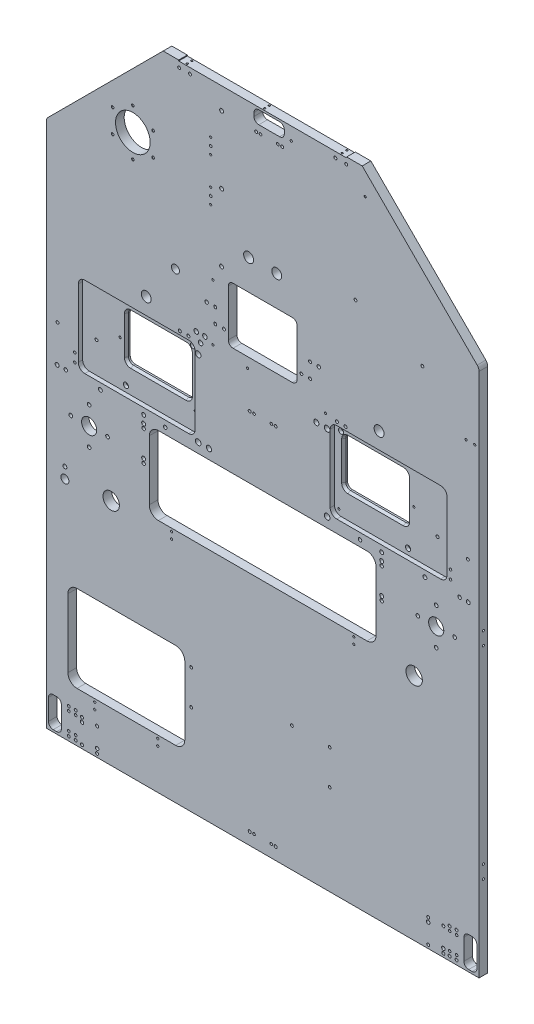
from build123d import *
from OCP.BRepFilletAPI import BRepFilletAPI_MakeChamfer

# Parameters (mm, degrees)
SKIZZE1_R                                            = 11.5
SKIZZE1_R_2                                          = 19
LINEAR_AUSTRAGEN1_DEPTH                              = 20
SCHNITT_LINEAR_AUSTRAGEN1_DEPTH                      = 10
SKIZZE5_R                                            = 11.5
SCHNITT_LINEAR_AUSTRAGEN2_DEPTH                      = 1795.575158638
M8_GEWINDEBOHRUNG1_F_R_ABST_TZUNG_D                  = 6.8
M8_GEWINDEKERNLOCH5_F_R_AUSLAUFSPLATTE_D             = 6.8
M6_F_R_DAS_BLECH_GEGEN_KLAPPE2_D                     = 5
M6_F_R_DAS_BLECH_GEGEN_KLAPPE2_DEPTH                 = 17
M6_F_R_DAS_BLECH_GEGEN_KLAPPE2_TIP                   = 1.502151548
M8_GEWINDEBOHRUNG1_D                                 = 6.8
M8_GEWINDEBOHRUNG1_DEPTH                             = 22.25
M8_GEWINDEBOHRUNG1_TIP                               = 2.042926105
M8_GEWINDEBOHRUNG2_D                                 = 6.8
M8_GEWINDEBOHRUNG2_DEPTH                             = 22.25
M8_GEWINDEBOHRUNG2_TIP                               = 2.042926105
SKIZZE70_R                                           = 17.5
SCHNITT_LINEAR_AUSTRAGEN4_DEPTH                      = 20
F_8_5_8_5_DURCHMESSER_BOHRUNG1_D                     = 8.5
SKIZZE76_R                                           = 35
SCHNITT_LINEAR_AUSTRAGEN6_F_R_DEN_ZYKLUS_DEPTH       = 3
F_8_0_8_DURCHMESSER_BOHRUNG1_D                       = 8
F_8_5_8_5_F_R_DIE_GETRIEBESHALTER_D                  = 9
F_8_5_8_5_F_R_DIE_GETRIEBESHALTER_CBORE_D            = 15
F_8_5_8_5_F_R_DIE_GETRIEBESHALTER_CBORE_DEPTH        = 8
FASE2_SIZE                                           = 3.5
FASE2_SIZE2                                          = 6.062177826
F_8_0_8_DURCHMESSER_BOHRUNG2_D                       = 8
F_8_0_8_DURCHMESSER_BOHRUNG2_DEPTH                   = 9
F_8_0_8_DURCHMESSER_BOHRUNG2_TIP                     = 2.403442476
M6_GEWINDEBOHRUNG1_F_R_RUTSCHE_D                     = 5
M6_GEWINDEBOHRUNG1_F_R_RUTSCHE_DEPTH                 = 17
M6_GEWINDEBOHRUNG1_F_R_RUTSCHE_CSINK_D               = 6.05
M6_GEWINDEBOHRUNG1_F_R_RUTSCHE_CSINK_ANGLE           = 90
M6_GEWINDEBOHRUNG1_F_R_RUTSCHE_TIP                   = 1.502151548
F_9_0_9_DURCHMESSER_BOHRUNG1_D                       = 9
F_13_0_13_DURCHMESSER_BOHRUNG1_D                     = 13
F_7_0_7_DURCHMESSER_BOHRUNG1_D                       = 7
M6_GEWINDEBOHRUNG1_D                                 = 5
M6_GEWINDEBOHRUNG1_DEPTH                             = 17
M6_GEWINDEBOHRUNG1_CSINK_D                           = 6.05
M6_GEWINDEBOHRUNG1_CSINK_ANGLE                       = 90
M6_GEWINDEBOHRUNG1_TIP                               = 1.502151548
SCHNITT_LINEAR_AUSTRAGEN6_DEPTH                      = 30
F_12_0_12_DURCHMESSER_BOHRUNG1_D                     = 12
F_12_0_12_DURCHMESSER_BOHRUNG1_DEPTH                 = 15
F_12_0_12_DURCHMESSER_BOHRUNG1_TIP                   = 3.605163714
M8_GEWINDEBOHRUNG1_F_R_DIE_T_REN_D                   = 6.8
VERRUNDUNG1_R                                        = 15
F_6_0_6_DURCHMESSER_BOHRUNG3_D                       = 6
F_6_0_6_DURCHMESSER_BOHRUNG3_DEPTH                   = 20
F_6_0_6_DURCHMESSER_BOHRUNG3_TIP                     = 1.802581857
F_12_0_12_DURCHM_F_R_GETRIEBE_POSITIONIE_D           = 12
F_12_0_12_DURCHM_F_R_GETRIEBE_POSITIONIE_DEPTH       = 7
M8_GEWINDEBOHRUNG1_F_R_DIE_FUSS_D                    = 6.8
F_8_0_8_DURCHMESSER_BOHRUNG3_D                       = 8
F_8_0_8_DURCHMESSER_BOHRUNG3_DEPTH                   = 20
F_8_0_8_DURCHMESSER_BOHRUNG3_TIP                     = 2.403442476
SKIZZE113_W                                          = 388
SKIZZE113_H                                          = 20
SCHNITT_LINEAR_AUSTRAGEN7_DEPTH                      = 2
M5_GEWINDEBOHRUNG1_D                                 = 4.2
M5_GEWINDEBOHRUNG1_DEPTH                             = 14
M5_GEWINDEBOHRUNG1_TIP                               = 1.2618073
M5_GEWINDEBOHRUNG2_D                                 = 4.2
M5_GEWINDEBOHRUNG2_DEPTH                             = 14
M5_GEWINDEBOHRUNG2_CSINK_D                           = 5.05
M5_GEWINDEBOHRUNG2_CSINK_ANGLE                       = 90
M5_GEWINDEBOHRUNG2_TIP                               = 1.2618073
M6_GEWINDEBOHRUNG2_D                                 = 5
M6_GEWINDEBOHRUNG2_DEPTH                             = 17
M6_GEWINDEBOHRUNG2_TIP                               = 1.502151548
M5_GEWINDEBOHRUNG3_D                                 = 4.2
M5_GEWINDEBOHRUNG3_DEPTH                             = 14
M5_GEWINDEBOHRUNG3_TIP                               = 1.2618073
M5_GEWINDEBOHRUNG4_D                                 = 4.2
M5_GEWINDEBOHRUNG4_DEPTH                             = 14
M5_GEWINDEBOHRUNG4_CSINK_D                           = 5.05
M5_GEWINDEBOHRUNG4_CSINK_ANGLE                       = 90
M5_GEWINDEBOHRUNG4_TIP                               = 1.2618073
M6_GEWINDEBOHRUNG4_D                                 = 5
M6_GEWINDEBOHRUNG4_DEPTH                             = 17
M6_GEWINDEBOHRUNG4_TIP                               = 1.502151548
M6_GEWINDEBOHRUNG5_D                                 = 5
M6_GEWINDEBOHRUNG5_DEPTH                             = 17
M6_GEWINDEBOHRUNG5_TIP                               = 1.502151548
M6_GEWINDEBOHRUNG7_D                                 = 5
M6_GEWINDEBOHRUNG7_DEPTH                             = 17
M6_GEWINDEBOHRUNG7_TIP                               = 1.502151548
M6_GEWINDEBOHRUNG8_D                                 = 5
M6_GEWINDEBOHRUNG8_DEPTH                             = 17
M6_GEWINDEBOHRUNG8_TIP                               = 1.502151548
M12X1_5_GEWINDEBOHRUNG1_D                            = 10.5
M6_GEWINDEBOHRUNG9_D                                 = 5
M6_GEWINDEBOHRUNG9_DEPTH                             = 17
M6_GEWINDEBOHRUNG9_TIP                               = 1.502151548
F_6_0MM_STIFTLOCH1_D                                 = 6
F_6_0MM_STIFTLOCH1_DEPTH                             = 12
F_6_0MM_STIFTLOCH1_TIP                               = 1.802581857
SCHNITT_LINEAR_AUSTRAGEN8_DEPTH                      = 1795.575158638
DURCHGANGSLOCH_F_R_M61_D                             = 6.6
M6_GEWINDEBOHRUNG10_D                                = 5
M6_GEWINDEBOHRUNG10_DEPTH                            = 17
M6_GEWINDEBOHRUNG10_TIP                              = 1.502151548
M20X1_5_GEWINDEBOHRUNG1_D                            = 18.5
DURCHGANGSLOCH_F_R_M81_D                             = 9
SKIZZE157_R                                          = 40
SCHNITT_LINEAR_AUSTRAGEN9_DEPTH                      = 1795.575158638
M6_GEWINDEBOHRUNG11_D                                = 5
M6_GEWINDEBOHRUNG11_CSINK_D                          = 6.05
M6_GEWINDEBOHRUNG11_CSINK_ANGLE                      = 90
FORMSENKUNG_F_R_M6_SENKSCHRAUBE_MIT_INNE_D           = 6
FORMSENKUNG_F_R_M6_SENKSCHRAUBE_MIT_INNE_CSINK_D     = 13
FORMSENKUNG_F_R_M6_SENKSCHRAUBE_MIT_INNE_CSINK_ANGLE = 90


with BuildPart() as part:
    # Skizze1 → Linear austragen1 (new body)
    with BuildSketch(Plane.XY):
        Polygon((-270, 1490), (0, 1220), (0, 0), (-1000, 0), (-1000, 1220), (-730, 1490), align=None)
        with Locations((-231, 979)):
            Circle(SKIZZE1_R, mode=Mode.SUBTRACT)
        with Locations((-769, 979)):
            Circle(SKIZZE1_R, mode=Mode.SUBTRACT)
        with Locations((-850, 530)):
            Circle(SKIZZE1_R_2, mode=Mode.SUBTRACT)
        with Locations((-150, 530)):
            Circle(SKIZZE1_R_2, mode=Mode.SUBTRACT)
        with BuildLine():
            Line((-259, 725), (-741, 725))
            ThreePointArc((-741, 725), (-755.849242405, 718.849242405), (-762, 704))
            Line((-762, 704), (-762, 566))
            ThreePointArc((-762, 566), (-755.849242405, 551.150757595), (-741, 545))
            Line((-741, 545), (-259, 545))
            ThreePointArc((-259, 545), (-244.150757595, 551.150757595), (-238, 566))
            Line((-238, 566), (-238, 704))
            ThreePointArc((-238, 704), (-244.150757595, 718.849242405), (-259, 725))
        make_face(mode=Mode.SUBTRACT)
        with BuildLine():
            Line((-826, 822), (-826, 910))
            ThreePointArc((-826, 910), (-822.778174593, 917.778174593), (-815, 921))
            Line((-815, 921), (-687, 921))
            ThreePointArc((-687, 921), (-679.221825407, 917.778174593), (-676, 910))
            Line((-676, 910), (-676, 822))
            ThreePointArc((-676, 822), (-679.221825407, 814.221825407), (-687, 811))
            Line((-687, 811), (-815, 811))
            ThreePointArc((-815, 811), (-822.778174593, 814.221825407), (-826, 822))
        make_face(mode=Mode.SUBTRACT)
        with BuildLine():
            Line((-185, 811), (-313, 811))
            ThreePointArc((-313, 811), (-320.778174593, 814.221825407), (-324, 822))
            Line((-324, 822), (-324, 910))
            ThreePointArc((-324, 910), (-320.778174593, 917.778174593), (-313, 921))
            Line((-313, 921), (-185, 921))
            ThreePointArc((-185, 921), (-177.221825407, 917.778174593), (-174, 910))
            Line((-174, 910), (-174, 822))
            ThreePointArc((-174, 822), (-177.221825407, 814.221825407), (-185, 811))
        make_face(mode=Mode.SUBTRACT)
    extrude(amount=LINEAR_AUSTRAGEN1_DEPTH)

    # Skizze4 → Schnitt-Linear austragen1 (cut)
    with BuildSketch(Plane.XY.offset(20)):
        with BuildLine():
            Line((-329, 941), (-89, 941))
            ThreePointArc((-89, 941), (-78.393398282, 936.606601718), (-74, 926))
            Line((-74, 926), (-74, 769))
            ThreePointArc((-74, 769), (-78.393398282, 758.393398282), (-89, 754))
            Line((-89, 754), (-329, 754))
            ThreePointArc((-329, 754), (-339.606601718, 758.393398282), (-344, 769))
            Line((-344, 769), (-344, 926))
            ThreePointArc((-344, 926), (-339.606601718, 936.606601718), (-329, 941))
        make_face()
        with BuildLine():
            Line((-911, 941), (-671, 941))
            ThreePointArc((-671, 941), (-660.393398282, 936.606601718), (-656, 926))
            Line((-656, 926), (-656, 769))
            ThreePointArc((-656, 769), (-660.393398282, 758.393398282), (-671, 754))
            Line((-671, 754), (-911, 754))
            ThreePointArc((-911, 754), (-921.606601718, 758.393398282), (-926, 769))
            Line((-926, 769), (-926, 926))
            ThreePointArc((-926, 926), (-921.606601718, 936.606601718), (-911, 941))
        make_face()
    extrude(amount=-SCHNITT_LINEAR_AUSTRAGEN1_DEPTH, mode=Mode.SUBTRACT)

    # Skizze5 → Schnitt-Linear austragen2 (cut, through all)
    with BuildSketch(Plane.XY.offset(20)):
        with Locations((-467.5, 1176)):
            Circle(SKIZZE5_R)
        with Locations((-532.5, 1176)):
            Circle(SKIZZE5_R)
        with BuildLine():
            Line((-431.5, 976), (-568.5, 976))
            ThreePointArc((-568.5, 976), (-576.278174593, 979.221825407), (-579.5, 987))
            Line((-579.5, 987), (-579.5, 1095))
            ThreePointArc((-579.5, 1095), (-576.278174593, 1102.778174593), (-568.5, 1106))
            Line((-568.5, 1106), (-431.5, 1106))
            ThreePointArc((-431.5, 1106), (-423.721825407, 1102.778174593), (-420.5, 1095))
            Line((-420.5, 1095), (-420.5, 987))
            ThreePointArc((-420.5, 987), (-423.721825407, 979.221825407), (-431.5, 976))
        make_face()
    extrude(amount=-SCHNITT_LINEAR_AUSTRAGEN2_DEPTH, mode=Mode.SUBTRACT)

    # M8 Gewindebohrung1 f_r Abst_tzung (through all)
    with Locations(Plane(origin=(0, 0, 0), x_dir=(-1, 0, 0), z_dir=(0, 0, -1))):
        with Locations((948, 70), (948, 10), (52, 10), (52, 70), (609.5, 1003.9), (410.5, 1003.9), (390.5, 1037.9), (390.5, 1003.9), (609.5, 1037.9), (589.5, 1003.9), (455, 1436), (515, 1436), (932, 70), (932, 10), (68, 70), (68, 10), (470, 28), (530, 28), (470, 869), (530, 869)):
            Hole(M8_GEWINDEBOHRUNG1_F_R_ABST_TZUNG_D / 2)

    # M8 Gewindekernloch5 für Auslaufsplatte (through all)
    with Locations(Plane(origin=(0, 0, 0), x_dir=(-1, 0, 0), z_dir=(0, 0, -1))):
        with Locations((974, 825), (894, 825), (26, 825), (106, 825)):
            Hole(M8_GEWINDEKERNLOCH5_F_R_AUSLAUFSPLATTE_D / 2)

    # M6 für das Blech gegen Klappe2
    with Locations(Plane(origin=(423.526055636, -217.574382619, 0), x_dir=(1, 0, 0), z_dir=(0, 0, -1))):
        with Locations((-740.726055636, -1192.874382619), (-703.526055636, -1169.674382619), (-1106.326055636, -1192.874382619), (-1143.526055636, -1169.674382619)):
            Hole(M6_F_R_DAS_BLECH_GEGEN_KLAPPE2_D / 2, depth=M6_F_R_DAS_BLECH_GEGEN_KLAPPE2_DEPTH)
            with Locations((0, 0, -(M6_F_R_DAS_BLECH_GEGEN_KLAPPE2_DEPTH + M6_F_R_DAS_BLECH_GEGEN_KLAPPE2_TIP / 2))):  # 118° drill point
                Cone(0, M6_F_R_DAS_BLECH_GEGEN_KLAPPE2_D / 2, M6_F_R_DAS_BLECH_GEGEN_KLAPPE2_TIP, mode=Mode.SUBTRACT)

    # M8 Gewindebohrung1
    with Locations(Plane.XY.offset(20)):
        with Locations((-131, 1159)):
            Hole(M8_GEWINDEBOHRUNG1_D / 2, depth=M8_GEWINDEBOHRUNG1_DEPTH)
            with Locations((0, 0, -(M8_GEWINDEBOHRUNG1_DEPTH + M8_GEWINDEBOHRUNG1_TIP / 2))):  # 118° drill point
                Cone(0, M8_GEWINDEBOHRUNG1_D / 2, M8_GEWINDEBOHRUNG1_TIP, mode=Mode.SUBTRACT)

    # M8 Gewindebohrung2
    with Locations(Plane.XY.offset(20)):
        with Locations((-285.5, 1214)):
            Hole(M8_GEWINDEBOHRUNG2_D / 2, depth=M8_GEWINDEBOHRUNG2_DEPTH)
            with Locations((0, 0, -(M8_GEWINDEBOHRUNG2_DEPTH + M8_GEWINDEBOHRUNG2_TIP / 2))):  # 118° drill point
                Cone(0, M8_GEWINDEBOHRUNG2_D / 2, M8_GEWINDEBOHRUNG2_TIP, mode=Mode.SUBTRACT)

    # Skizze70 → Schnitt-Linear austragen4 (cut)
    with BuildSketch(Plane.XY.offset(20)):
        with Locations((-99, 654)):
            Circle(SKIZZE70_R)
        with Locations((-901, 654)):
            Circle(SKIZZE70_R)
    extrude(amount=-SCHNITT_LINEAR_AUSTRAGEN4_DEPTH, mode=Mode.SUBTRACT)

    # Ø8.5 (8.5) Durchmesser Bohrung1 (through all)
    with Locations(Plane.XY.offset(20)):
        with Locations((-99, 696.5), (-141.5, 654), (-99, 611.5), (-56.5, 654), (-943.5, 654), (-901, 611.5), (-858.5, 654), (-901, 696.5)):
            Hole(F_8_5_8_5_DURCHMESSER_BOHRUNG1_D / 2)

    # Skizze76 → Schnitt-Linear austragen6 für den Zyklussmotor (cut)
    with BuildSketch(Plane(origin=(0, 0, 0), x_dir=(-1, 0, 0), z_dir=(0, 0, -1))):
        with Locations((99, 654)):
            Circle(SKIZZE76_R)
        with Locations((901, 654)):
            Circle(SKIZZE76_R)
    extrude(amount=-SCHNITT_LINEAR_AUSTRAGEN6_F_R_DEN_ZYKLUS_DEPTH, mode=Mode.SUBTRACT)

    # Ø8.0 (8) Durchmesser Bohrung1 (through all)
    with Locations(Plane(origin=(0, 0, 0), x_dir=(-1, 0, 0), z_dir=(0, 0, -1))):
        with Locations((370.5, 1037.9), (629.5, 1037.9)):
            Hole(F_8_0_8_DURCHMESSER_BOHRUNG1_D / 2)

    # Ø8.5 (8.5) für die Getriebeshalter (through all)
    with Locations(Plane(origin=(0, 0, 0), x_dir=(-1, 0, 0), z_dir=(0, 0, -1))):
        with Locations((25, 739.5), (125, 739.5), (225, 739.5), (225, 722), (225, 652), (775, 652), (775, 722), (775, 739.5), (875, 739.5), (975, 739.5)):
            CounterBoreHole(F_8_5_8_5_F_R_DIE_GETRIEBESHALTER_D / 2, F_8_5_8_5_F_R_DIE_GETRIEBESHALTER_CBORE_D / 2, F_8_5_8_5_F_R_DIE_GETRIEBESHALTER_CBORE_DEPTH)

    # Fase2: one chamfer whose edges measure the first distance from different faces: ONE call of the kernel's chamfer builder (chamfer() names one face for all edges)
    fase2_edges_1 = [part.edges().sort_by_distance(p)[0] for p in [
        (-320.778174593, 814.221825407, 10),
        (-324, 866, 10),
        (-320.778174593, 917.778174593, 10),
        (-249, 811, 10),
        (-177.221825407, 814.221825407, 10),
        (-174, 866, 10),
        (-249, 921, 10),
        (-177.221825407, 917.778174593, 10),
    ]]
    fase2_side_1 = [part.faces().sort_by_distance(p)[0] for p in [
        (-337.284221473, 934.284221473, 10),
    ]]
    fase2_edges_2 = [part.edges().sort_by_distance(p)[0] for p in [
        (-751, 921, 10),
        (-822.778174593, 917.778174593, 10),
        (-679.221825407, 917.778174593, 10),
        (-826, 866, 10),
        (-676, 866, 10),
        (-822.778174593, 814.221825407, 10),
        (-679.221825407, 814.221825407, 10),
        (-751, 811, 10),
    ]]
    fase2_side_2 = [part.faces().sort_by_distance(p)[0] for p in [
        (-791, 937.715658361, 10),
    ]]
    fase2 = BRepFilletAPI_MakeChamfer(part.part.solid().wrapped)
    for e in fase2_edges_1:
        fase2.Add(FASE2_SIZE, FASE2_SIZE2, e.wrapped, fase2_side_1[0].wrapped)  # the first distance lies on this face
    for e in fase2_edges_2:
        fase2.Add(FASE2_SIZE, FASE2_SIZE2, e.wrapped, fase2_side_2[0].wrapped)  # the first distance lies on this face
    add(Compound.cast(fase2.Shape()), mode=Mode.REPLACE)

    # Ø8.0 (8) Durchmesser Bohrung2
    with Locations(Plane.XY.offset(20)):
        with Locations((-225, 712), (-225, 642), (-775, 642), (-775, 712), (-275, 739.5), (-45, 739.5), (-955, 739.5), (-725, 739.5)):
            Hole(F_8_0_8_DURCHMESSER_BOHRUNG2_D / 2, depth=F_8_0_8_DURCHMESSER_BOHRUNG2_DEPTH)
            with Locations((0, 0, -(F_8_0_8_DURCHMESSER_BOHRUNG2_DEPTH + F_8_0_8_DURCHMESSER_BOHRUNG2_TIP / 2))):  # 118° drill point
                Cone(0, F_8_0_8_DURCHMESSER_BOHRUNG2_D / 2, F_8_0_8_DURCHMESSER_BOHRUNG2_TIP, mode=Mode.SUBTRACT)

    # M6 Gewindebohrung1 für Rutsche
    with Locations(Plane(origin=(0, 0, 0), x_dir=(-1, 0, 0), z_dir=(0, 0, -1))):
        with Locations((213.5, 742), (213.5, 562), (786.5, 562), (786.5, 742), (366.5, 877), (160.6, 857.2), (839.4, 857.2), (633.5, 877)):
            CounterSinkHole(M6_GEWINDEBOHRUNG1_F_R_RUTSCHE_D / 2, M6_GEWINDEBOHRUNG1_F_R_RUTSCHE_CSINK_D / 2, depth=M6_GEWINDEBOHRUNG1_F_R_RUTSCHE_DEPTH, counter_sink_angle=M6_GEWINDEBOHRUNG1_F_R_RUTSCHE_CSINK_ANGLE)
            with Locations((0, 0, -(M6_GEWINDEBOHRUNG1_F_R_RUTSCHE_DEPTH + M6_GEWINDEBOHRUNG1_F_R_RUTSCHE_TIP / 2))):  # 118° drill point
                Cone(0, M6_GEWINDEBOHRUNG1_F_R_RUTSCHE_D / 2, M6_GEWINDEBOHRUNG1_F_R_RUTSCHE_TIP, mode=Mode.SUBTRACT)

    # Ø9.0 (9) Durchmesser Bohrung1 (through all)
    with Locations(Plane.XY.offset(20)):
        with Locations((-595, 1438), (-595, 1282), (-595, 1126)):
            Hole(F_9_0_9_DURCHMESSER_BOHRUNG1_D / 2)

    # Ø13.0 (13) Durchmesser Bohrung1 (through all)
    with Locations(Plane(origin=(0, 0, 0), x_dir=(-1, 0, 0), z_dir=(0, 0, -1))):
        with Locations((351, 923.63), (649, 923.63), (649, 747.63), (351, 747.63)):
            Hole(F_13_0_13_DURCHMESSER_BOHRUNG1_D / 2)

    # Ø7.0 (7) Durchmesser Bohrung1 (through all)
    with Locations(Plane.XY.offset(20)):
        with Locations((-328.5, 949), (-308.5, 949), (-691.5, 949), (-671.5, 949)):
            Hole(F_7_0_7_DURCHMESSER_BOHRUNG1_D / 2)

    # M6 Gewindebohrung1
    with Locations(Plane(origin=(0, 0, 0), x_dir=(-1, 0, 0), z_dir=(0, 0, -1))):
        with Locations((334, 766.63), (366, 796.63), (634, 766.63), (666, 796.63)):
            CounterSinkHole(M6_GEWINDEBOHRUNG1_D / 2, M6_GEWINDEBOHRUNG1_CSINK_D / 2, depth=M6_GEWINDEBOHRUNG1_DEPTH, counter_sink_angle=M6_GEWINDEBOHRUNG1_CSINK_ANGLE)
            with Locations((0, 0, -(M6_GEWINDEBOHRUNG1_DEPTH + M6_GEWINDEBOHRUNG1_TIP / 2))):  # 118° drill point
                Cone(0, M6_GEWINDEBOHRUNG1_D / 2, M6_GEWINDEBOHRUNG1_TIP, mode=Mode.SUBTRACT)

    # Skizze98 → Schnitt-Linear austragen6 (cut)
    with BuildSketch(Plane(origin=(0, 0, 0), x_dir=(-1, 0, 0), z_dir=(0, 0, -1))):
        with BuildLine():
            Line((16, 75), (24, 75))
            ThreePointArc((24, 75), (31.778174593, 71.778174593), (35, 64))
            Line((35, 64), (35, 16))
            ThreePointArc((35, 16), (31.778174593, 8.221825407), (24, 5))
            Line((24, 5), (16, 5))
            ThreePointArc((16, 5), (8.221825407, 8.221825407), (5, 16))
            Line((5, 16), (5, 64))
            ThreePointArc((5, 64), (8.221825407, 71.778174593), (16, 75))
        make_face()
        with BuildLine():
            Line((965, 64), (965, 16))
            ThreePointArc((965, 16), (968.221825407, 8.221825407), (976, 5))
            Line((976, 5), (984, 5))
            ThreePointArc((984, 5), (991.778174593, 8.221825407), (995, 16))
            Line((995, 16), (995, 64))
            ThreePointArc((995, 64), (991.778174593, 71.778174593), (984, 75))
            Line((984, 75), (976, 75))
            ThreePointArc((976, 75), (968.221825407, 71.778174593), (965, 64))
        make_face()
        with BuildLine():
            Line((461, 1483), (509, 1483))
            ThreePointArc((509, 1483), (516.778174593, 1479.778174593), (520, 1472))
            Line((520, 1472), (520, 1464))
            ThreePointArc((520, 1464), (516.778174593, 1456.221825407), (509, 1453))
            Line((509, 1453), (461, 1453))
            ThreePointArc((461, 1453), (453.221825407, 1456.221825407), (450, 1464))
            Line((450, 1464), (450, 1472))
            ThreePointArc((450, 1472), (453.221825407, 1479.778174593), (461, 1483))
        make_face()
    extrude(amount=-SCHNITT_LINEAR_AUSTRAGEN6_DEPTH, mode=Mode.SUBTRACT)

    # Ø12.0 (12) Durchmesser Bohrung1
    with Locations(Plane.XY.offset(20)):
        with Locations((-376, 923.63), (-624, 747.63)):
            Hole(F_12_0_12_DURCHMESSER_BOHRUNG1_D / 2, depth=F_12_0_12_DURCHMESSER_BOHRUNG1_DEPTH)
            with Locations((0, 0, -(F_12_0_12_DURCHMESSER_BOHRUNG1_DEPTH + F_12_0_12_DURCHMESSER_BOHRUNG1_TIP / 2))):  # 118° drill point
                Cone(0, F_12_0_12_DURCHMESSER_BOHRUNG1_D / 2, F_12_0_12_DURCHMESSER_BOHRUNG1_TIP, mode=Mode.SUBTRACT)

    # M8 Gewindebohrung1 für die Türen (through all)
    with Locations(Plane(origin=(0, 0, 0), x_dir=(-1, 0, 0), z_dir=(0, 0, -1))):
        with Locations((693, 1475), (668, 1475), (332, 1475), (307, 1475)):
            Hole(M8_GEWINDEBOHRUNG1_F_R_DIE_T_REN_D / 2)

    # Verrundung1
    verrundung1_edges = [part.edges().sort_by_distance(p)[0] for p in [
        (-1000, 1220, 10),
        (0, 1220, 10),
    ]]
    fillet(verrundung1_edges, radius=VERRUNDUNG1_R)

    # Ø6.0 (6) Durchmesser Bohrung3
    with Locations(Plane(origin=(0, 0, 0), x_dir=(-1, 0, 0), z_dir=(0, 0, -1))):
        with Locations((52, 60), (52, 20), (465, 1436), (505, 1436), (948, 20), (948, 60), (68, 60), (68, 20), (932, 60), (932, 20), (520, 28), (480, 28), (480, 869), (520, 869)):
            Hole(F_6_0_6_DURCHMESSER_BOHRUNG3_D / 2, depth=F_6_0_6_DURCHMESSER_BOHRUNG3_DEPTH)
            with Locations((0, 0, -(F_6_0_6_DURCHMESSER_BOHRUNG3_DEPTH + F_6_0_6_DURCHMESSER_BOHRUNG3_TIP / 2))):  # 118° drill point
                Cone(0, F_6_0_6_DURCHMESSER_BOHRUNG3_D / 2, F_6_0_6_DURCHMESSER_BOHRUNG3_TIP, mode=Mode.SUBTRACT)

    # Ø12.0 (12) Durchm für Getriebe Positionieren
    with Locations(Plane.XY.offset(10)):
        with Locations((-671, 925), (-826, 768), (-174, 768), (-329, 925)):
            Hole(F_12_0_12_DURCHM_F_R_GETRIEBE_POSITIONIE_D / 2, depth=F_12_0_12_DURCHM_F_R_GETRIEBE_POSITIONIE_DEPTH)

    # M8 Gewindebohrung1 für die Fuss (through all)
    with Locations(Plane.XY.offset(20)):
        with Locations((-917.5, 63), (-882.5, 63), (-917.5, 8), (-882.5, 8), (-117.5, 8), (-117.5, 63), (-82.5, 63), (-82.5, 8)):
            Hole(M8_GEWINDEBOHRUNG1_F_R_DIE_FUSS_D / 2)

    # Ø8.0 (8) Durchmesser Bohrung3
    with Locations(Plane.XY.offset(20)):
        with Locations((-917.5, 53), (-882.5, 18), (-117.5, 53), (-82.5, 18)):
            Hole(F_8_0_8_DURCHMESSER_BOHRUNG3_D / 2, depth=F_8_0_8_DURCHMESSER_BOHRUNG3_DEPTH)
            with Locations((0, 0, -(F_8_0_8_DURCHMESSER_BOHRUNG3_DEPTH + F_8_0_8_DURCHMESSER_BOHRUNG3_TIP / 2))):  # 118° drill point
                Cone(0, F_8_0_8_DURCHMESSER_BOHRUNG3_D / 2, F_8_0_8_DURCHMESSER_BOHRUNG3_TIP, mode=Mode.SUBTRACT)

    # Skizze113 → Schnitt-Linear austragen7 (cut)
    with BuildSketch(Plane(origin=(0, 1490, 0), x_dir=(1, 0, 0), z_dir=(0, 1, 0))):
        with Locations((-500, -10)):
            Rectangle(SKIZZE113_W, SKIZZE113_H)
    extrude(amount=-SCHNITT_LINEAR_AUSTRAGEN7_DEPTH, mode=Mode.SUBTRACT)

    # M5 Gewindebohrung1
    with Locations(Plane(origin=(0, 1488, 0), x_dir=(1, 0, 0), z_dir=(0, 1, 0))):
        with Locations((-679, -4.5), (-679, -15.5), (-321, -4.5), (-321, -15.5), (-500, -4.5), (-500, -15.5)):
            Hole(M5_GEWINDEBOHRUNG1_D / 2, depth=M5_GEWINDEBOHRUNG1_DEPTH)
            with Locations((0, 0, -(M5_GEWINDEBOHRUNG1_DEPTH + M5_GEWINDEBOHRUNG1_TIP / 2))):  # 118° drill point
                Cone(0, M5_GEWINDEBOHRUNG1_D / 2, M5_GEWINDEBOHRUNG1_TIP, mode=Mode.SUBTRACT)

    # M5 Gewindebohrung2
    with Locations(Plane(origin=(283.626435368, -135.044247588, 20), x_dir=(-1, 0, 0), z_dir=(0, 0, 1))):
        with Locations((546.626435368, -1567.044247588)):
            CounterSinkHole(M5_GEWINDEBOHRUNG2_D / 2, M5_GEWINDEBOHRUNG2_CSINK_D / 2, depth=M5_GEWINDEBOHRUNG2_DEPTH, counter_sink_angle=M5_GEWINDEBOHRUNG2_CSINK_ANGLE)
            with Locations((0, 0, -(M5_GEWINDEBOHRUNG2_DEPTH + M5_GEWINDEBOHRUNG2_TIP / 2))):  # 118° drill point
                Cone(0, M5_GEWINDEBOHRUNG2_D / 2, M5_GEWINDEBOHRUNG2_TIP, mode=Mode.SUBTRACT)

    # M6 Gewindebohrung2
    with Locations(Plane.XY.offset(20)):
        with Locations((-10, 1062), (-30, 1062)):
            Hole(M6_GEWINDEBOHRUNG2_D / 2, depth=M6_GEWINDEBOHRUNG2_DEPTH)
            with Locations((0, 0, -(M6_GEWINDEBOHRUNG2_DEPTH + M6_GEWINDEBOHRUNG2_TIP / 2))):  # 118° drill point
                Cone(0, M6_GEWINDEBOHRUNG2_D / 2, M6_GEWINDEBOHRUNG2_TIP, mode=Mode.SUBTRACT)

    # M5 Gewindebohrung3
    with Locations(Plane(origin=(0, 0, 0), x_dir=(-1, 0, 0), z_dir=(0, 0, -1))):
        with Locations((884.786796564, 1219.247691321), (906, 1198.034487885), (804.176623509, 1096.211111395), (782.963420074, 1117.42431483)):
            Hole(M5_GEWINDEBOHRUNG3_D / 2, depth=M5_GEWINDEBOHRUNG3_DEPTH)
            with Locations((0, 0, -(M5_GEWINDEBOHRUNG3_DEPTH + M5_GEWINDEBOHRUNG3_TIP / 2))):  # 118° drill point
                Cone(0, M5_GEWINDEBOHRUNG3_D / 2, M5_GEWINDEBOHRUNG3_TIP, mode=Mode.SUBTRACT)

    # M5 Gewindebohrung4
    with Locations(Plane(origin=(0, 0, 0), x_dir=(-1, 0, 0), z_dir=(0, 0, -1))):
        with Locations((253, 1422), (747, 1422)):
            CounterSinkHole(M5_GEWINDEBOHRUNG4_D / 2, M5_GEWINDEBOHRUNG4_CSINK_D / 2, depth=M5_GEWINDEBOHRUNG4_DEPTH, counter_sink_angle=M5_GEWINDEBOHRUNG4_CSINK_ANGLE)
            with Locations((0, 0, -(M5_GEWINDEBOHRUNG4_DEPTH + M5_GEWINDEBOHRUNG4_TIP / 2))):  # 118° drill point
                Cone(0, M5_GEWINDEBOHRUNG4_D / 2, M5_GEWINDEBOHRUNG4_TIP, mode=Mode.SUBTRACT)

    # M6 Gewindebohrung4
    with Locations(Plane.XY.offset(20)):
        with Locations((-615, 1089.5), (-615, 959.5), (-534.9, 952.7), (-354.9, 952.7)):
            Hole(M6_GEWINDEBOHRUNG4_D / 2, depth=M6_GEWINDEBOHRUNG4_DEPTH)
            with Locations((0, 0, -(M6_GEWINDEBOHRUNG4_DEPTH + M6_GEWINDEBOHRUNG4_TIP / 2))):  # 118° drill point
                Cone(0, M6_GEWINDEBOHRUNG4_D / 2, M6_GEWINDEBOHRUNG4_TIP, mode=Mode.SUBTRACT)

    # M6 Gewindebohrung5
    with Locations(Plane.XY.offset(20)):
        with Locations((-289.5, 538), (-289.5, 523), (-710.5, 538), (-710.5, 523), (-434, 1458)):
            Hole(M6_GEWINDEBOHRUNG5_D / 2, depth=M6_GEWINDEBOHRUNG5_DEPTH)
            with Locations((0, 0, -(M6_GEWINDEBOHRUNG5_DEPTH + M6_GEWINDEBOHRUNG5_TIP / 2))):  # 118° drill point
                Cone(0, M6_GEWINDEBOHRUNG5_D / 2, M6_GEWINDEBOHRUNG5_TIP, mode=Mode.SUBTRACT)

    # M6 Gewindebohrung7
    with Locations(Plane.ZY.offset(1000)):
        with Locations((10, 193), (10, 223), (10, 660), (10, 690)):
            Hole(M6_GEWINDEBOHRUNG7_D / 2, depth=M6_GEWINDEBOHRUNG7_DEPTH)
            with Locations((0, 0, -(M6_GEWINDEBOHRUNG7_DEPTH + M6_GEWINDEBOHRUNG7_TIP / 2))):  # 118° drill point
                Cone(0, M6_GEWINDEBOHRUNG7_D / 2, M6_GEWINDEBOHRUNG7_TIP, mode=Mode.SUBTRACT)

    # M6 Gewindebohrung8
    with Locations(Plane(origin=(0, 0, 0), x_dir=(0, 0, -1), z_dir=(1, 0, 0))):
        with Locations((-10, 193), (-10, 223), (-10, 660), (-10, 690)):
            Hole(M6_GEWINDEBOHRUNG8_D / 2, depth=M6_GEWINDEBOHRUNG8_DEPTH)
            with Locations((0, 0, -(M6_GEWINDEBOHRUNG8_DEPTH + M6_GEWINDEBOHRUNG8_TIP / 2))):  # 118° drill point
                Cone(0, M6_GEWINDEBOHRUNG8_D / 2, M6_GEWINDEBOHRUNG8_TIP, mode=Mode.SUBTRACT)

    # M12x1.5 Gewindebohrung1 (through all)
    with Locations(Plane.XY.offset(20)):
        with Locations((-633.5, 967), (-653.5, 967), (-643.5, 949)):
            Hole(M12X1_5_GEWINDEBOHRUNG1_D / 2)

    # M6 Gewindebohrung9
    with Locations(Plane(origin=(0, 0, 20), x_dir=(-1, 0, 0), z_dir=(0, 0, 1))):
        with Locations((620, -1372.5), (620, -1337.5), (620, -1272.5), (620, -1237.5)):
            Hole(M6_GEWINDEBOHRUNG9_D / 2, depth=M6_GEWINDEBOHRUNG9_DEPTH)
            with Locations((0, 0, -(M6_GEWINDEBOHRUNG9_DEPTH + M6_GEWINDEBOHRUNG9_TIP / 2))):  # 118° drill point
                Cone(0, M6_GEWINDEBOHRUNG9_D / 2, M6_GEWINDEBOHRUNG9_TIP, mode=Mode.SUBTRACT)

    # Ø6.0mm Stiftloch1
    with Locations(Plane(origin=(0, 0, 20), x_dir=(-1, 0, 0), z_dir=(0, 0, 1))):
        with Locations((620, -1255), (620, -1355)):
            Hole(F_6_0MM_STIFTLOCH1_D / 2, depth=F_6_0MM_STIFTLOCH1_DEPTH)
            with Locations((0, 0, -(F_6_0MM_STIFTLOCH1_DEPTH + F_6_0MM_STIFTLOCH1_TIP / 2))):  # 118° drill point
                Cone(0, F_6_0MM_STIFTLOCH1_D / 2, F_6_0MM_STIFTLOCH1_TIP, mode=Mode.SUBTRACT)

    # Skizze148 → Schnitt-Linear austragen8 (cut, through all)
    with BuildSketch(Plane.XY.offset(20)):
        with BuildLine():
            Line((-929, 315), (-701, 315))
            ThreePointArc((-701, 315), (-686.150757595, 308.849242405), (-680, 294))
            Line((-680, 294), (-680, 136))
            ThreePointArc((-680, 136), (-686.150757595, 121.150757595), (-701, 115))
            Line((-701, 115), (-929, 115))
            ThreePointArc((-929, 115), (-943.849242405, 121.150757595), (-950, 136))
            Line((-950, 136), (-950, 294))
            ThreePointArc((-950, 294), (-943.849242405, 308.849242405), (-929, 315))
        make_face()
    extrude(amount=-SCHNITT_LINEAR_AUSTRAGEN8_DEPTH, mode=Mode.SUBTRACT)

    # Durchgangsloch für M61 (through all)
    with Locations(Plane.XY.offset(20)):
        with Locations((-665, 289), (-665, 209), (-345, 289), (-432.528320846, 289), (-345, 209)):
            Hole(DURCHGANGSLOCH_F_R_M61_D / 2)

    # M6 Gewindebohrung10
    with Locations(Plane.XY.offset(20)):
        with Locations((-888, 108), (-888, 93), (-742.5, 108), (-742.5, 93)):
            Hole(M6_GEWINDEBOHRUNG10_D / 2, depth=M6_GEWINDEBOHRUNG10_DEPTH)
            with Locations((0, 0, -(M6_GEWINDEBOHRUNG10_DEPTH + M6_GEWINDEBOHRUNG10_TIP / 2))):  # 118° drill point
                Cone(0, M6_GEWINDEBOHRUNG10_D / 2, M6_GEWINDEBOHRUNG10_TIP, mode=Mode.SUBTRACT)

    # M20x1.5 Gewindebohrung1 (through all)
    with Locations(Plane(origin=(0, 0, 0), x_dir=(-1, 0, 0), z_dir=(0, 0, -1))):
        with Locations((957, 520), (701.5, 1068)):
            Hole(M20X1_5_GEWINDEBOHRUNG1_D / 2)

    # Durchgangsloch für M81 (through all)
    with Locations(Plane(origin=(0, 0, 0), x_dir=(-1, 0, 0), z_dir=(0, 0, -1))):
        with Locations((957, 545)):
            Hole(DURCHGANGSLOCH_F_R_M81_D / 2)

    # Skizze157 → Schnitt-Linear austragen9 (cut, through all)
    with BuildSketch(Plane.XY.offset(20)):
        with Locations((-800, 1292)):
            Circle(SKIZZE157_R)
    extrude(amount=-SCHNITT_LINEAR_AUSTRAGEN9_DEPTH, mode=Mode.SUBTRACT)

    # M6 Gewindebohrung11 (through all)
    with Locations(Plane.XY.offset(20)):
        with Locations((-800, 1346), (-753.234628196, 1319), (-753.234628196, 1265), (-800, 1238), (-846.765371804, 1265), (-846.765371804, 1319), (-800, 1292)):
            CounterSinkHole(M6_GEWINDEBOHRUNG11_D / 2, M6_GEWINDEBOHRUNG11_CSINK_D / 2, counter_sink_angle=M6_GEWINDEBOHRUNG11_CSINK_ANGLE)

    # Formsenkung für M6 Senkschraube mit Innensechskant2 (through all)
    with Locations(Plane(origin=(0, 0, 0), x_dir=(-1, 0, 0), z_dir=(0, 0, -1))):
        with Locations((934, 784.5), (934, 764.5), (66, 784.5), (66, 764.5)):
            CounterSinkHole(FORMSENKUNG_F_R_M6_SENKSCHRAUBE_MIT_INNE_D / 2, FORMSENKUNG_F_R_M6_SENKSCHRAUBE_MIT_INNE_CSINK_D / 2, counter_sink_angle=FORMSENKUNG_F_R_M6_SENKSCHRAUBE_MIT_INNE_CSINK_ANGLE)


solid = part.part
